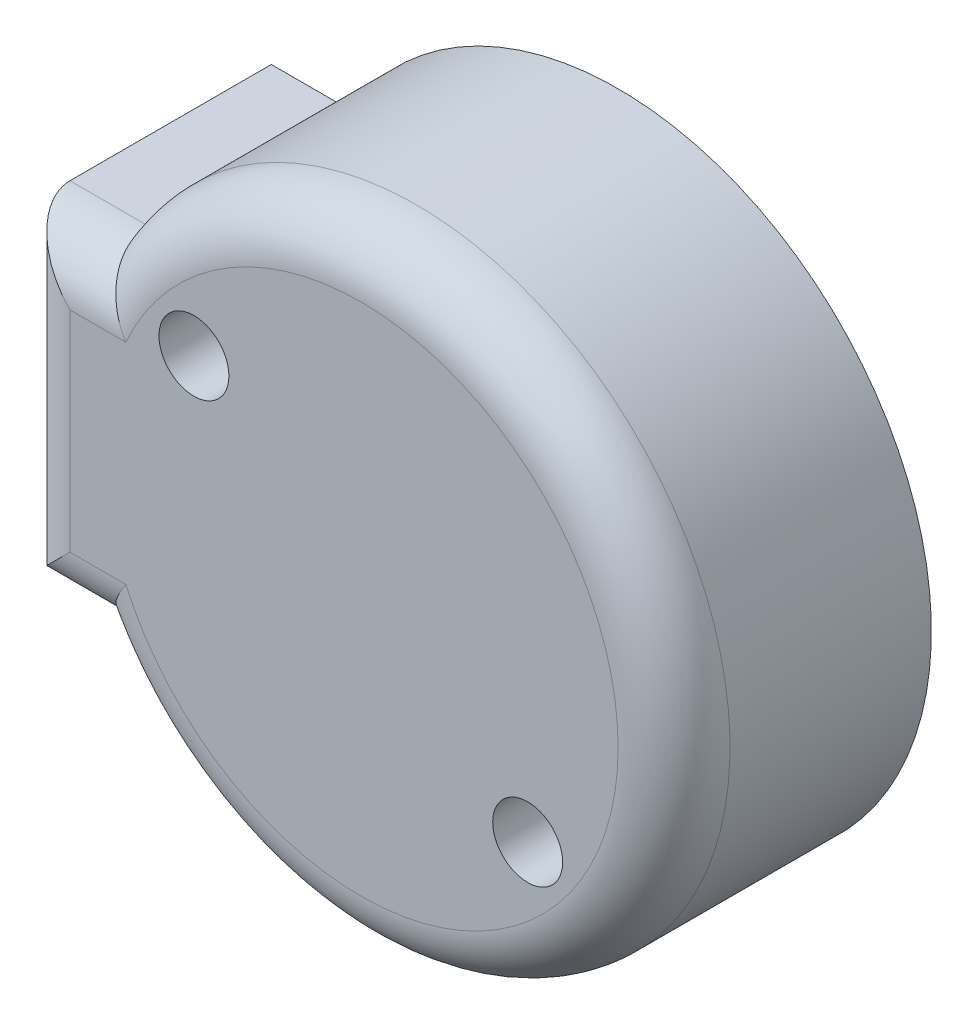
from build123d import *

# Parameters (mm, degrees)
SKETCH1_R           = 14.224
BOSS_EXTRUDE1_DEPTH = 11.684
SKETCH2_W           = 10.862447087
SKETCH2_H           = 14.605
BOSS_EXTRUDE2_DEPTH = 11.684
FILLET1_R           = 2.54
SKETCH3_R           = 1.5875
CUT_EXTRUDE1_DEPTH  = 11.684


with BuildPart() as part:
    # Sketch1 → Boss-Extrude1 (new body)
    with BuildSketch(Plane.XY):
        Circle(SKETCH1_R)
    extrude(amount=BOSS_EXTRUDE1_DEPTH)

    # Sketch2 → Boss-Extrude2 (add)
    with BuildSketch(Plane.XY.offset(11.684)):
        with Locations((-10.316776457, 0)):
            Rectangle(SKETCH2_W, SKETCH2_H)
    extrude(amount=-BOSS_EXTRUDE2_DEPTH)

    # Fillet1
    fillet1_edges = [part.edges().sort_by_distance(p)[0] for p in [
        (-13.97718912, 7.3025, 11.684),
        (-15.748, 0, 11.684),
        (-13.97718912, -7.3025, 11.684),
        (14.224, 0, 11.684),
    ]]
    fillet(fillet1_edges, radius=FILLET1_R - 0.0001)  # a hair under: the kernel refuses the full size

    # Sketch3 → Cut-Extrude1 (cut)
    with BuildSketch(Plane(origin=(0, 0, 0), x_dir=(-1, 0, 0), z_dir=(0, 0, -1))):
        with Locations((7.576884905, 5.772039513)):
            Circle(SKETCH3_R)
        with Locations((-7.576884905, -5.772039513)):
            Circle(SKETCH3_R)
    extrude(amount=-CUT_EXTRUDE1_DEPTH, mode=Mode.SUBTRACT)


solid = part.part
